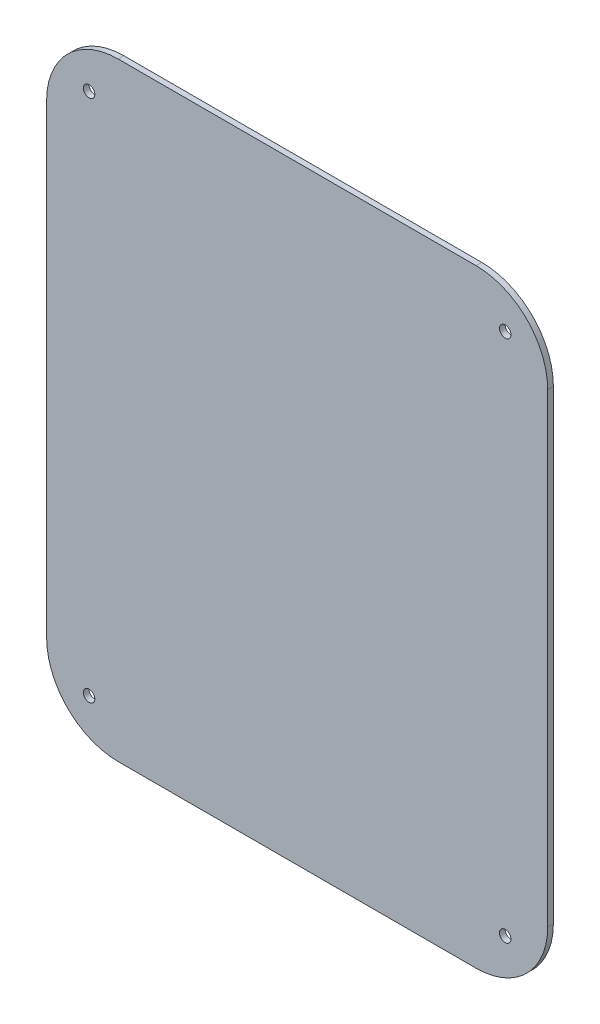
from build123d import *

# Parameters (mm, degrees)
SKETCH1_R           = 1.6
BOSS_EXTRUDE1_DEPTH = 1.5875


with BuildPart() as part:
    # Sketch1 → Boss-Extrude1 (new body)
    with BuildSketch(Plane.XY):
        with BuildLine():
            Line((42.5, 123), (-57.5, 123))
            ThreePointArc((-57.5, 123), (-71.642135624, 117.142135624), (-77.5, 103))
            Line((-77.5, 103), (-77.5, -27))
            ThreePointArc((-77.5, -27), (-71.642135624, -41.142135624), (-57.5, -47))
            Line((-57.5, -47), (42.5, -47))
            ThreePointArc((42.5, -47), (56.642135624, -41.142135624), (62.5, -27))
            Line((62.5, -27), (62.5, 103))
            ThreePointArc((62.5, 103), (56.642135624, 117.142135624), (42.5, 123))
        make_face()
        with Locations((-65.631727984, -35.131727984)):
            Circle(SKETCH1_R, mode=Mode.SUBTRACT)
        with Locations((50.631727984, -35.131727984)):
            Circle(SKETCH1_R, mode=Mode.SUBTRACT)
        with Locations((50.631727984, 111.131727984)):
            Circle(SKETCH1_R, mode=Mode.SUBTRACT)
        with Locations((-65.631727984, 111.131727984)):
            Circle(SKETCH1_R, mode=Mode.SUBTRACT)
    extrude(amount=BOSS_EXTRUDE1_DEPTH)


solid = part.part
